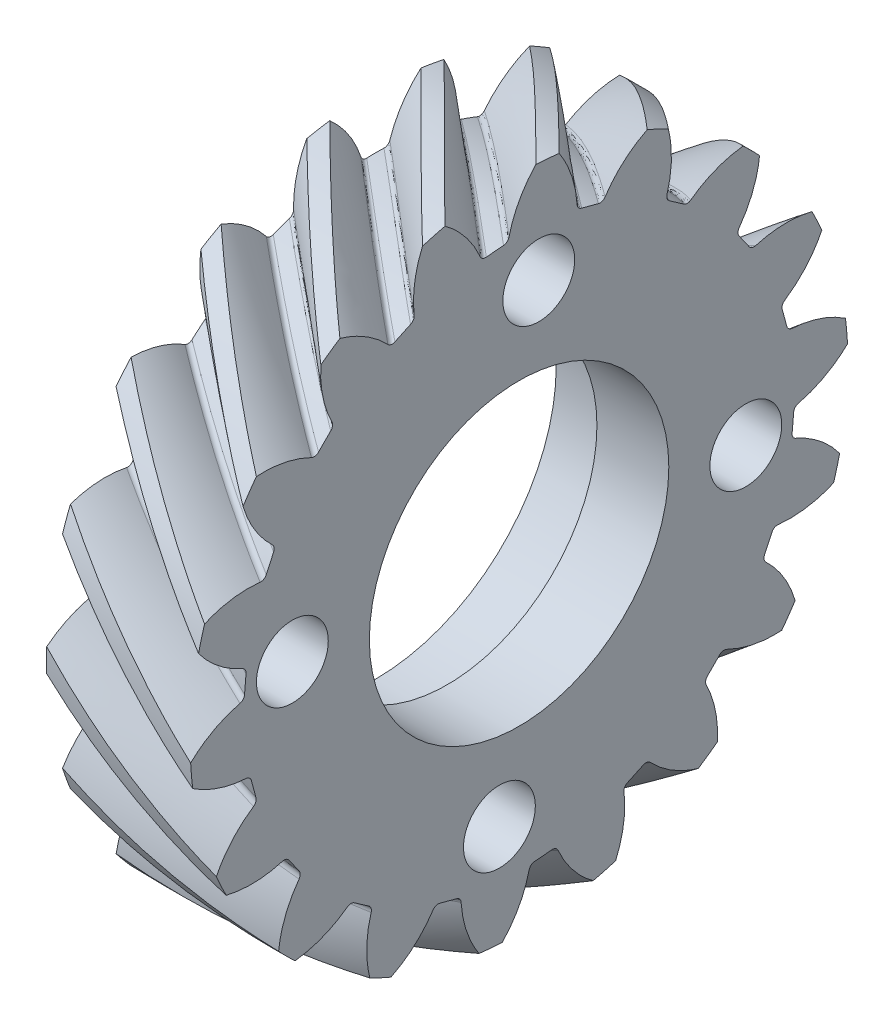
from build123d import *

# Parameters (mm, degrees)
BASPROSKE_W            = 12
BASPROSKE_H            = 27.455844123
TOOTHCUTRH_PITCH       = 172.510156388
TOOTHCUTRH_HEIGHT      = 12
TOOTHCUTRH_RADIUS      = 27.455844123
TOOTHCUTRH_START_ANGLE = -90
TEETHCUTSRH_COUNT      = 18
TEETHCUTSRH_ANGLE      = 340
BORSKE_R               = 15
BORE_DEPTH             = 62.5000025
SKETCH3_R              = 1.5
CUT_EXTRUDE1_DEPTH     = 12
SKETCH4_R              = 3
CUT_EXTRUDE2_DEPTH     = 6
SKETCH6_R              = 15.1
CUT_EXTRUDE3_DEPTH     = 6
SKETCH7_R              = 15
SKETCH7_R_2            = 12.5
BOSS_EXTRUDE1_DEPTH    = 6


with BuildPart() as part:
    # BasProSke → Base-Revolve (revolve)
    with BuildSketch(Plane(origin=(0, 0, 0), x_dir=(1, 0, 0), z_dir=(0, 1, 0)), mode=Mode.PRIVATE) as base_revolve_sk:
        with Locations((6, 13.727922062)):
            Rectangle(BASPROSKE_W, BASPROSKE_H)
    revolve(base_revolve_sk.sketch.rotate(Axis((-10, 0, 0), (1, 0, 0)), 180), axis=Axis((-10, 0, 0), (1, 0, 0)))

    # ToothCutRH: sweep along a helix
    with BuildLine() as toothcutrh_path:
        add(Helix(TOOTHCUTRH_PITCH, TOOTHCUTRH_HEIGHT, TOOTHCUTRH_RADIUS, center=(0, 0, 0), direction=(1, 0, 0), mode=Mode.PRIVATE).rotate(Axis((0, 0, 0), (1, 0, 0)), TOOTHCUTRH_START_ANGLE))
    # TooCutSkeRH → ToothCutRH (sweep, cut)
    with BuildSketch(Plane(origin=(0, 0, 0), x_dir=(0, 0, -1), z_dir=(1, 0, 0))):
        with BuildLine():
            ThreePointArc((0.719832214, 22.944555367), (0, 22.955844123), (-0.719832214, 22.944555367))
            ThreePointArc((-0.719832214, 22.944555367), (-1.021785859, 23.034133161), (-1.210610775, 23.286215165))
            ThreePointArc((-1.210610775, 23.286215165), (-2.579137782, 25.873755641), (-4.705650677, 27.885266214))
            ThreePointArc((-4.705650677, 27.885266214), (0, 28.279519446), (4.705650677, 27.885266214))
            ThreePointArc((4.705650677, 27.885266214), (2.579137782, 25.873755641), (1.210610775, 23.286215165))
            ThreePointArc((1.210610775, 23.286215165), (1.021785859, 23.034133161), (0.719832214, 22.944555367))
        make_face()
    toothcutrh = sweep(path=toothcutrh_path.line, is_frenet=True, mode=Mode.SUBTRACT)

    # TeethCutsRH: ToothCutRH ×18 about axis
    teethcutsrh_axis = Axis((-10, 0, 0), (1, 0, 0))
    for i in range(1, TEETHCUTSRH_COUNT):
        add(toothcutrh.rotate(teethcutsrh_axis, i * TEETHCUTSRH_ANGLE / (TEETHCUTSRH_COUNT - 1)), mode=Mode.SUBTRACT)

    # BorSke → Bore (cut, symmetric)
    with BuildSketch(Plane(origin=(0, 0, 0), x_dir=(0, 0, -1), z_dir=(1, 0, 0))):
        with Locations(Location((0, 0, 0), (0, 0, 180))):
            Circle(BORSKE_R)
    extrude(amount=BORE_DEPTH, both=True, mode=Mode.SUBTRACT)

    # Sketch3 → Cut-Extrude1 (cut)
    with BuildSketch(Plane(origin=(12, 0, 0), x_dir=(0, 0, -1), z_dir=(1, 0, 0))):
        with Locations((1.64267089, 18.928857133)):
            Circle(SKETCH3_R)
        with Locations((18.928857133, -1.64267089)):
            Circle(SKETCH3_R)
        with Locations((-1.64267089, -18.928857133)):
            Circle(SKETCH3_R)
        with Locations((-18.928857133, 1.64267089)):
            Circle(SKETCH3_R)
    extrude(amount=-CUT_EXTRUDE1_DEPTH, mode=Mode.SUBTRACT)

    # Sketch4 → Cut-Extrude2 (cut)
    with BuildSketch(Plane(origin=(12, 0, 0), x_dir=(0, 0, -1), z_dir=(1, 0, 0))):
        with Locations((1.64267089, 18.928857133)):
            Circle(SKETCH4_R)
        with Locations((18.928857133, -1.64267089)):
            Circle(SKETCH4_R)
        with Locations((-1.64267089, -18.928857133)):
            Circle(SKETCH4_R)
        with Locations((-18.928857133, 1.64267089)):
            Circle(SKETCH4_R)
    extrude(amount=-CUT_EXTRUDE2_DEPTH, mode=Mode.SUBTRACT)

    # Sketch6 → Cut-Extrude3 (cut)
    with BuildSketch(Plane.ZY):
        Circle(SKETCH6_R)
    extrude(amount=-CUT_EXTRUDE3_DEPTH, mode=Mode.SUBTRACT)

    # Sketch7 → Boss-Extrude1 (add)
    with BuildSketch(Plane(origin=(12, 0, 0), x_dir=(0, 0, -1), z_dir=(1, 0, 0))):
        Circle(SKETCH7_R)
        Circle(SKETCH7_R_2, mode=Mode.SUBTRACT)
    extrude(amount=-BOSS_EXTRUDE1_DEPTH)


solid = part.part
